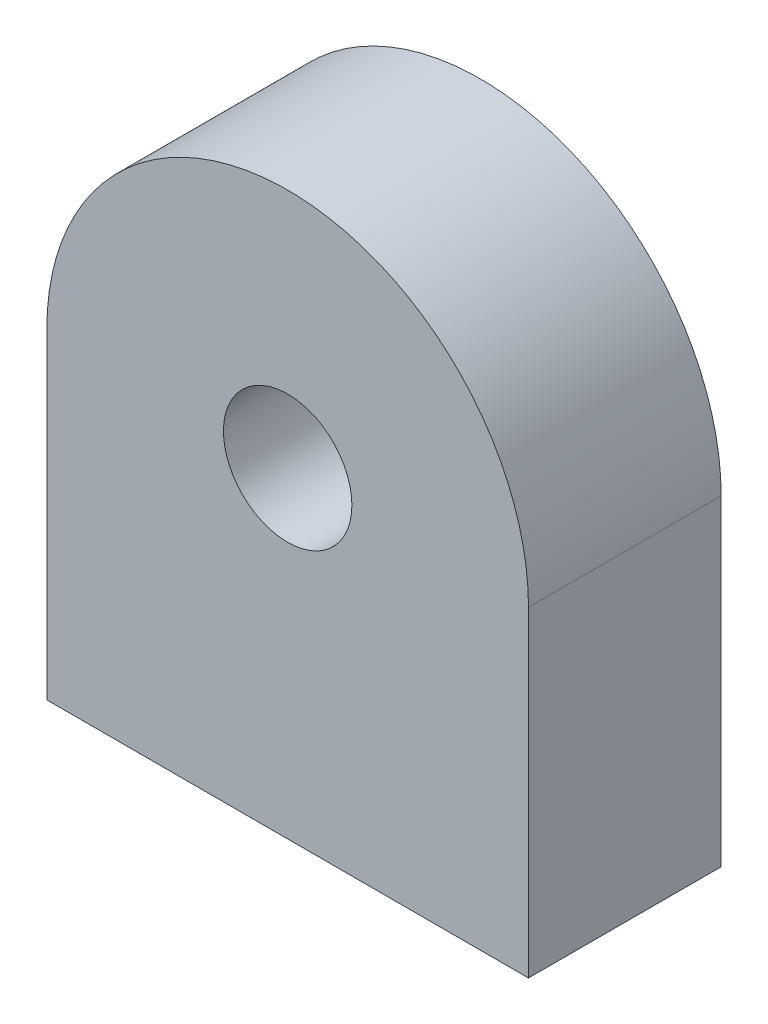
from build123d import *

# Parameters (mm, degrees)
SALIENTE_EXTRUIR1_DEPTH = 6
CROQUIS3_R              = 4
CORTAR_EXTRUIR1_DEPTH   = 48.634021455


with BuildPart() as part:
    # Croquis2 → Saliente-Extruir1 (new, symmetric)
    with BuildSketch(Plane.XY):
        with BuildLine():
            Line((0, 0), (-30, 0))
            Line((-30, 0), (-30, 20))
            ThreePointArc((-30, 20), (-15, 35), (0, 20))
            Line((0, 20), (0, 0))
        make_face()
    extrude(amount=SALIENTE_EXTRUIR1_DEPTH, both=True)

    # Croquis3 → Cortar-Extruir1 (cut, through all)
    with BuildSketch(Plane.XY.offset(6)):
        with Locations((-15, 20)):
            Circle(CROQUIS3_R)
    extrude(amount=-CORTAR_EXTRUIR1_DEPTH, mode=Mode.SUBTRACT)


solid = part.part
